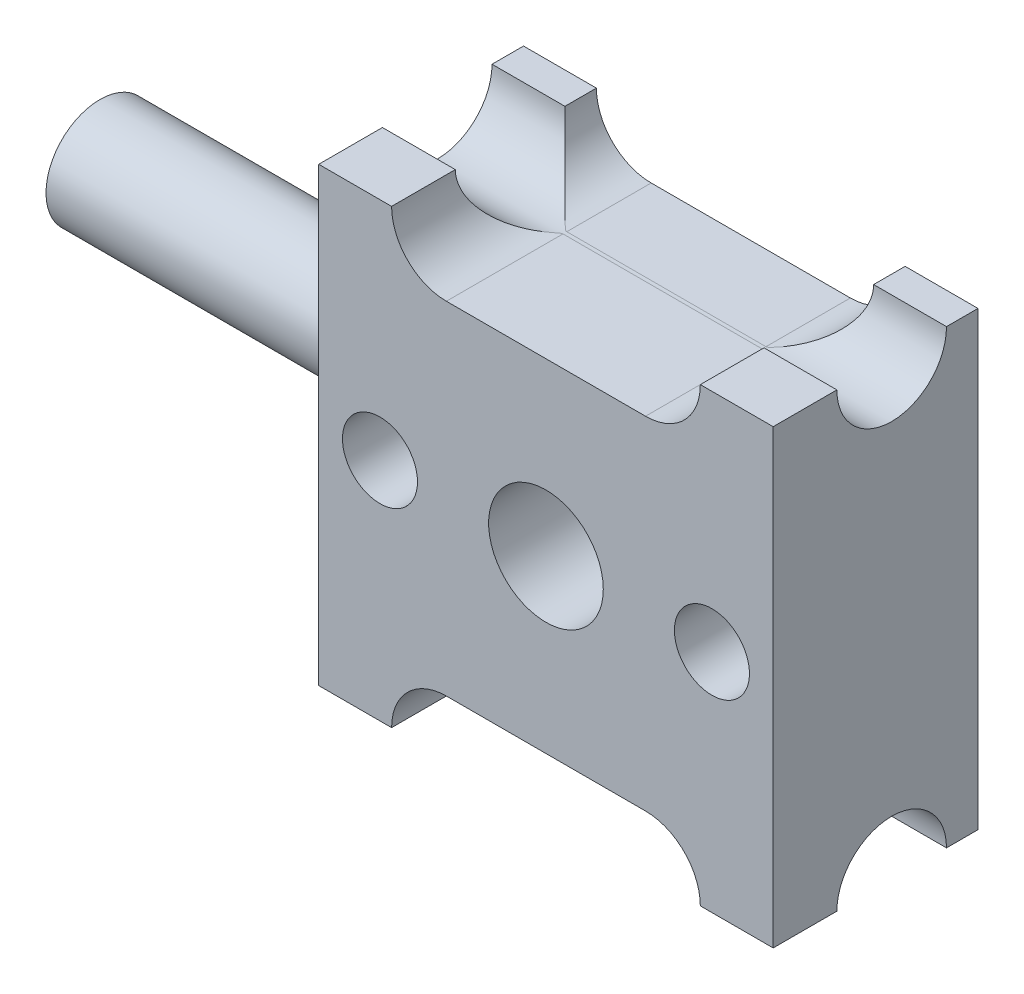
from build123d import *

# Parameters (mm, degrees)
SKETCH1_W           = 13.6906
SKETCH1_H           = 13.6
BOSS_EXTRUDE1_DEPTH = 6.17
SKETCH2_R           = 1.651
CUT_EXTRUDE1_DEPTH  = 17.484581534
CUT_EXTRUDE2_DEPTH  = 12.452817649
SKETCH4_R           = 1.7272
CUT_EXTRUDE3_DEPTH  = 12.452817822
SKETCH5_R           = 1.6256
BOSS_EXTRUDE2_DEPTH = 10.16
SKETCH6_R           = 1.1303
CUT_EXTRUDE4_DEPTH  = 20.325866881


with BuildPart() as part:
    # Sketch1 → Boss-Extrude1 (new body)
    with BuildSketch(Plane.XY):
        Rectangle(SKETCH1_W, SKETCH1_H)
    extrude(amount=BOSS_EXTRUDE1_DEPTH)

    # Sketch2 → Cut-Extrude1 (cut, through all)
    with BuildSketch(Plane(origin=(6.8453, 0, 0), x_dir=(0, 0, -1), z_dir=(1, 0, 0))):
        with Locations((-2.6, 6.8)):
            Circle(SKETCH2_R)
        with Locations((-2.6, -6.8)):
            Circle(SKETCH2_R)
    extrude(amount=-CUT_EXTRUDE1_DEPTH, mode=Mode.SUBTRACT)

    # Sketch3 → Cut-Extrude2 (cut, through all)
    with BuildSketch(Plane.XY.offset(6.17)):
        with BuildLine():
            ThreePointArc((-4.65, 6.8), (-4.166726189, 5.633273811), (-3, 5.15))
            Line((-3, 5.15), (3, 5.15))
            ThreePointArc((3, 5.15), (4.166726189, 5.633273811), (4.65, 6.8))
            Line((4.65, 6.8), (-4.65, 6.8))
        make_face()
        with BuildLine():
            ThreePointArc((4.65, -6.8), (4.166726189, -5.633273811), (3, -5.15))
            Line((3, -5.15), (-3, -5.15))
            ThreePointArc((-3, -5.15), (-4.166726189, -5.633273811), (-4.65, -6.8))
            Line((-4.65, -6.8), (4.65, -6.8))
        make_face()
    extrude(amount=-CUT_EXTRUDE2_DEPTH, mode=Mode.SUBTRACT)

    # Sketch4 → Cut-Extrude3 (cut, through all)
    with BuildSketch(Plane.XY.offset(6.17)):
        Circle(SKETCH4_R)
    extrude(amount=-CUT_EXTRUDE3_DEPTH, mode=Mode.SUBTRACT)

    # Sketch5 → Boss-Extrude2 (add)
    with BuildSketch(Plane.ZY.offset(6.8453)):
        with Locations((2.6, 0)):
            Circle(SKETCH5_R)
    extrude(amount=BOSS_EXTRUDE2_DEPTH)

    # Sketch6 → Cut-Extrude4 (cut, through all)
    with BuildSketch(Plane.XY.offset(6.17)):
        with Locations((-5, 0)):
            Circle(SKETCH6_R)
        with Locations((5, 0)):
            Circle(SKETCH6_R)
    extrude(amount=-CUT_EXTRUDE4_DEPTH, mode=Mode.SUBTRACT)


solid = part.part
